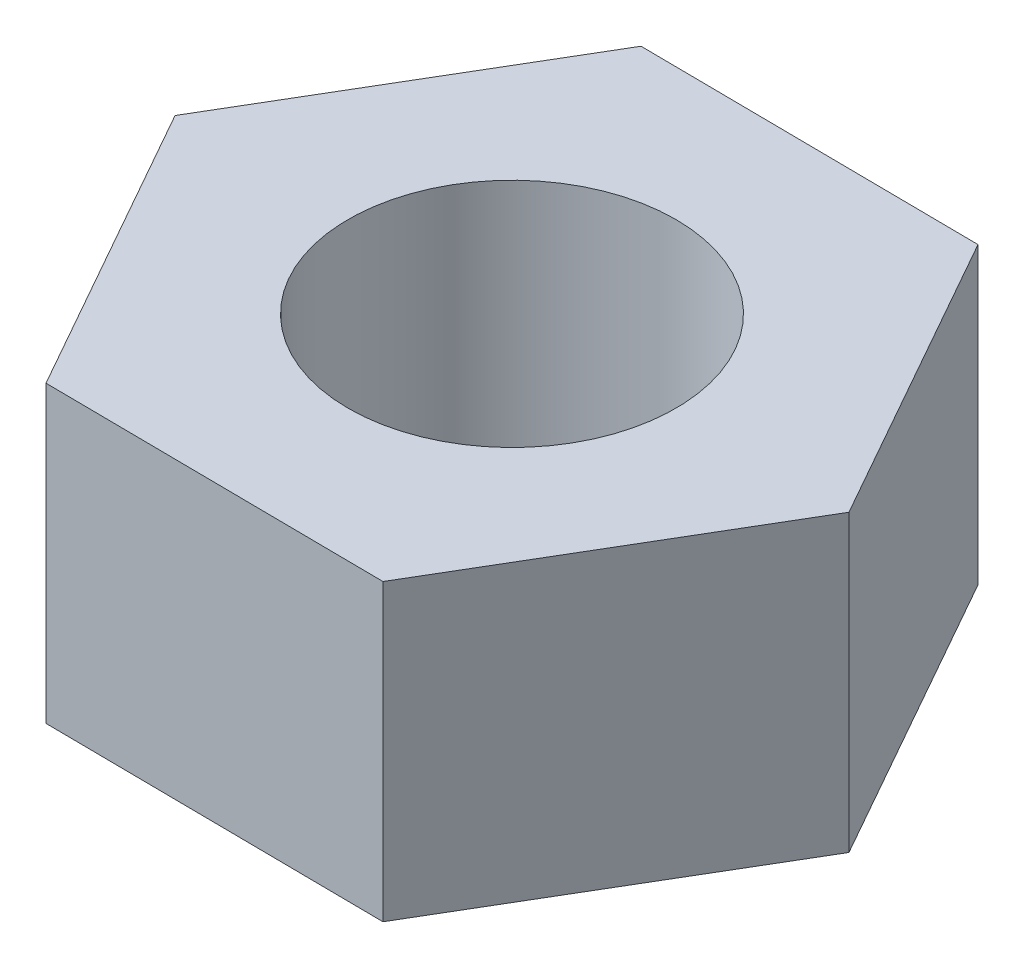
from build123d import *

# Parameters (mm, degrees)
SKETCH1_R           = 2.5
BOSS_EXTRUDE1_DEPTH = 4.5


with BuildPart() as part:
    # Sketch1 → Boss-Extrude1 (new body)
    with BuildSketch(Plane(origin=(0, 0, 0), x_dir=(1, 0, 0), z_dir=(0, 1, 0))):
        Polygon((2.641618547, 4.474578355), (-2.554289253, 4.524997946), (-5.1959078, 0.050419591), (-2.641618547, -4.474578355), (2.554289253, -4.524997946), (5.1959078, -0.050419591), align=None)
        Circle(SKETCH1_R, mode=Mode.SUBTRACT)
    extrude(amount=BOSS_EXTRUDE1_DEPTH)


solid = part.part
